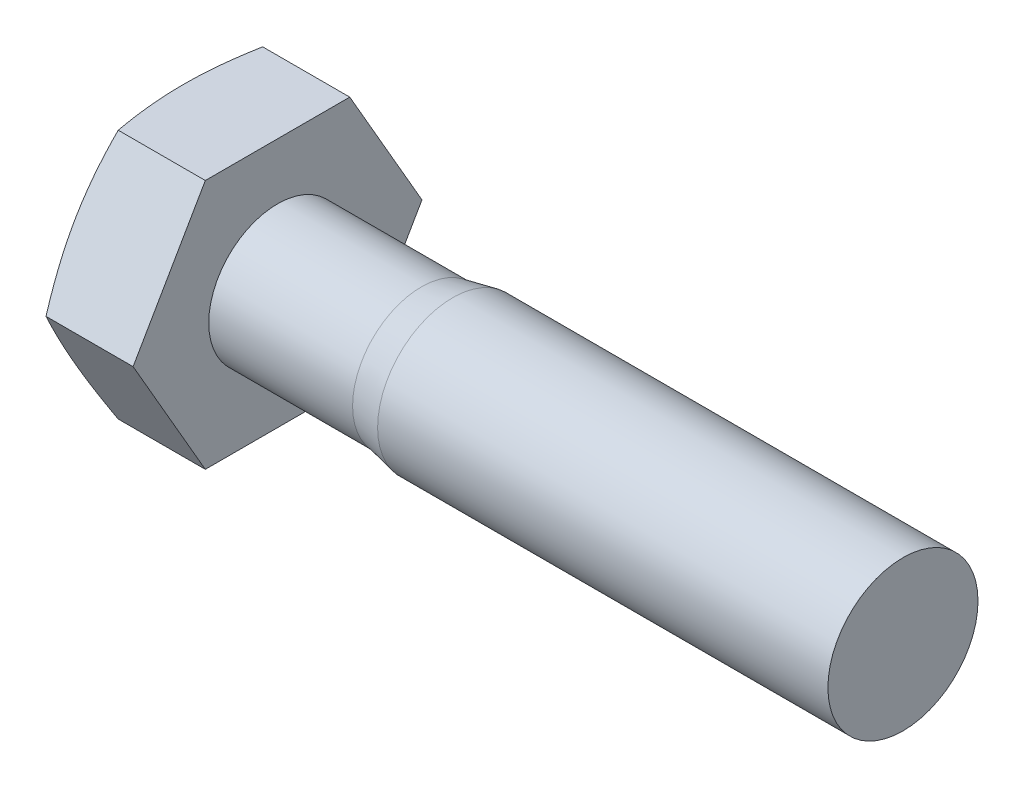
from build123d import *

# Parameters (mm, degrees)
BASEHEAD_DEPTH     = 4
SKETCH2_R          = 3
BASEBODY_DEPTH     = 25
SKETCH4_R          = 3.4
CUT_EXTRUDE1_DEPTH = 0.8


with BuildPart() as part:
    # Sketch1 → BaseHead (new body)
    with BuildSketch(Plane(origin=(0, 0, 0), x_dir=(0, 0, -1), z_dir=(1, 0, 0))):
        Polygon((5.773502692, 0), (2.886751346, 5), (-2.886751346, 5), (-5.773502692, 0), (-2.886751346, -5), (2.886751346, -5), align=None)
    extrude(amount=BASEHEAD_DEPTH)

    # Sketch2 → BaseBody (add)
    with BuildSketch(Plane(origin=(4, 0, 0), x_dir=(0, 0, -1), z_dir=(1, 0, 0))):
        Circle(SKETCH2_R)
    extrude(amount=BASEBODY_DEPTH)

    # Sketch3 → HeadChamfer (revolve, cut)
    with BuildSketch(Plane(origin=(3.161211974, 0, 2.612290718), x_dir=(0, 0, -1), z_dir=(0, 1, 0))):
        Polygon((8.38579341, 3.161211974), (8.38579341, 2.643099366), (6.962290718, 3.161211974), align=None)
    revolve(axis=Axis((-2.071354488, 0, 0), (1, 0, 0)), mode=Mode.SUBTRACT)

    # Sketch4 → Cut-Extrude1 (cut)
    with BuildSketch(Plane.ZY):
        Circle(SKETCH4_R)
    extrude(amount=-CUT_EXTRUDE1_DEPTH, mode=Mode.SUBTRACT)

    # Sketch5 → Cut-Revolve1 (revolve, cut)
    with BuildSketch(Plane(origin=(-2.67963122, 0, 8.17963122), x_dir=(0, 0, -1), z_dir=(0, 1, 0))):
        Polygon((11.17963122, -13.67963122), (10.92963122, -12.42963122), (10.92963122, -6.67963122), (13.67963122, -6.67963122), (13.67963122, -13.67963122), align=None)
    revolve(axis=Axis((-2.697175707, 0, 0), (1, 0, 0)), mode=Mode.SUBTRACT)


solid = part.part
